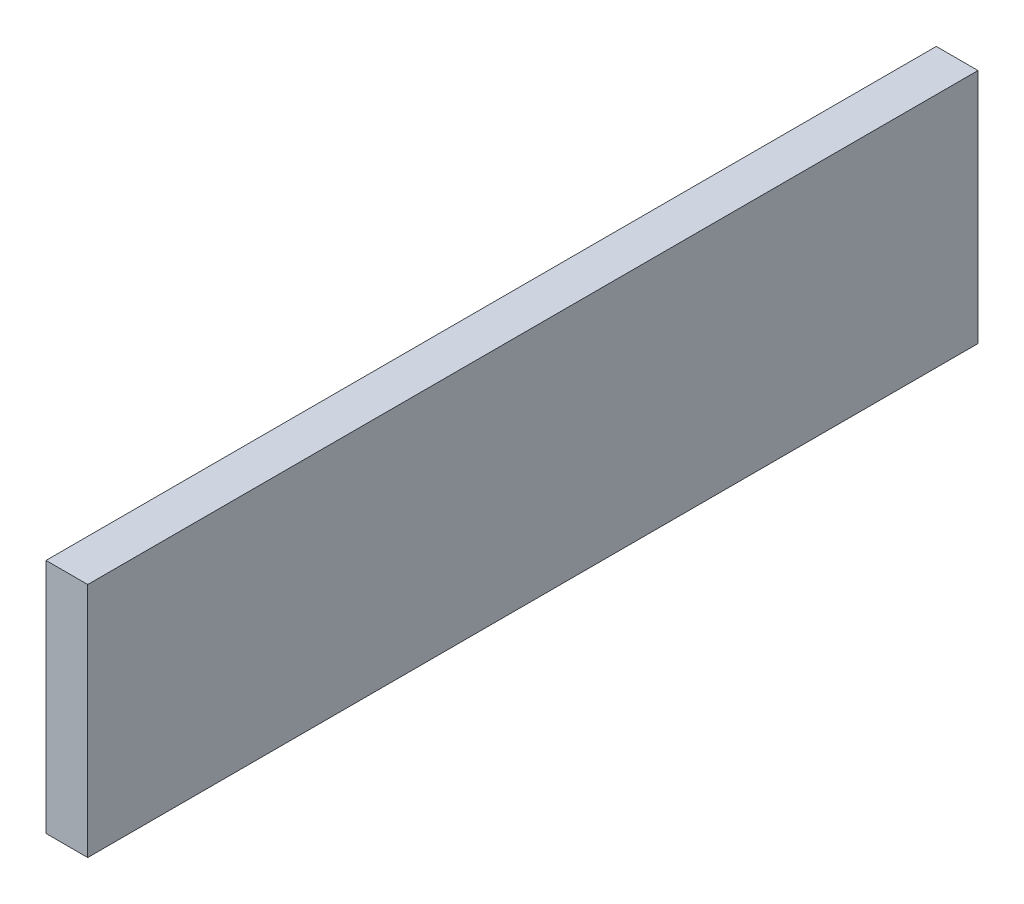
from build123d import *

# Parameters (mm, degrees)
ESBO_O1_W                = 320
ESBO_O1_H                = 85
RESSALTO_EXTRUS_O1_DEPTH = 15


with BuildPart() as part:
    # Esboço1 → Ressalto-extrusão1 (new body)
    with BuildSketch(Plane(origin=(0, 0, 0), x_dir=(0, 0, -1), z_dir=(1, 0, 0))):
        Rectangle(ESBO_O1_W, ESBO_O1_H)
    extrude(amount=RESSALTO_EXTRUS_O1_DEPTH)


solid = part.part
